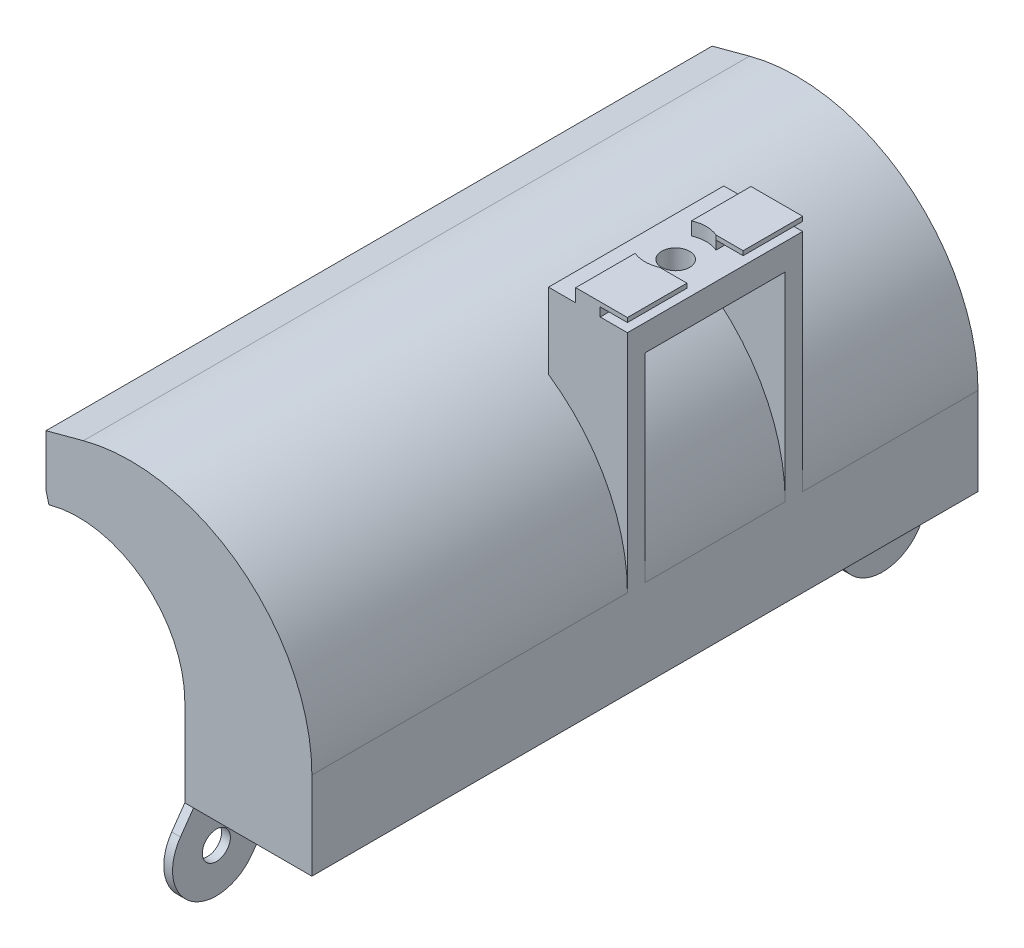
from build123d import *

# Parameters (mm, degrees)
RESSALTO_EXTRUS_O1_DEPTH          = 76
CORTE_EXTRUS_O2_DEPTH             = 91.309467661
RESSALTO_EXTRUS_O4_START          = -20
RESSALTO_EXTRUS_O4_DEPTH          = 20
CORTE_EXTRUS_O6_START             = -22
CORTE_EXTRUS_O6_DEPTH             = 16
ESBO_O12_R                        = 3.5
ESBO_O12_R_2                      = 1.6
CORTE_EXTRUS_O7_DEPTH             = 2
ESBO_O12_2_R                      = 1.6
CORTE_EXTRUS_O8_DEPTH             = 90.2814959
CORTE_EXTRUS_O8_DIRECTION_2_REACH = 91.281
RESSALTO_EXTRUS_O5_REACH          = 91.8
ESBO_O14_W                        = 6.792197014
ESBO_O14_H                        = 0.5
CASCA1_START                      = 1
CASCA1_DEPTH                      = 74
CASCA1_START_2                    = -3.278440116
CASCA1_2_OUTLINE_W                = 7
CASCA1_2_OUTLINE_H                = 18
CASCA1_2_OUTLINE_R                = 2.6
CASCA1_2_DEPTH                    = 1
CASCA1_START_3                    = -2.278440116
CASCA1_3_DEPTH                    = 1.5
RESSALTO_EXTRUS_O6_REACH          = 91.8
CORTE_EXTRUS_O9_DEPTH             = 91.309467661
CORTE_EXTRUS_O9_DEPTH_BACK        = 91.309467661
ESBO_O17_R                        = 1.6
RESSALTO_EXTRUS_O7_DEPTH          = 1


# Read off the part's stored shape, not the designer's step: Casca1
with BuildPart() as part:
    # Esboço1 → Ressalto-extrusão1 (new body)
    with BuildSketch(Plane.XY):
        with BuildLine():
            Line((-31.811733316, -8.523928252), (-26.064507457, -6.983963724))
            ThreePointArc((-26.064507457, -6.983963724), (-8.100799468, -10.557167407), (0, -26.983963724))
            Line((0, -26.983963724), (0, -36.983963724))
            Line((0, -36.983963724), (-14.5, -36.983963724))
            Line((-14.5, -36.983963724), (-14.5, -26.983963724))
            ThreePointArc((-14.5, -26.983963724), (-19.25882596, -17.334019289), (-29.811631303, -15.234935796))
            Line((-29.811631303, -15.234935796), (-30, -15.285409036))
            Line((-30, -15.285409036), (-31.811733316, -8.523928252))
        make_face()
    extrude(amount=RESSALTO_EXTRUS_O1_DEPTH)

    # Esboço3 → Corte-extrusão2 (cut, through all)
    with BuildSketch(Plane.XY.offset(76)):
        Polygon((-30.336464759, -14.029705462), (-30.336464759, -8.128631233), (-31.811733316, -8.523928252), align=None)
    extrude(amount=-CORTE_EXTRUS_O2_DEPTH, mode=Mode.SUBTRACT)

    # Esboço8 → Ressalto-extrusão4 (add)
    with BuildSketch(Plane(origin=(0, 0, 0), x_dir=(-1, 0, 0), z_dir=(0, 0, -1)).offset(RESSALTO_EXTRUS_O4_START)):
        with BuildLine():
            Line((9, -1.278440116), (5.9, -1.278440116))
            Line((5.9, -1.278440116), (5.9, 0.221559884))
            Line((5.9, 0.221559884), (3.1, 0.221559884))
            Line((3.1, 0.221559884), (3.1, -1.278440116))
            Line((3.1, -1.278440116), (0, -1.278440116))
            Line((0, -1.278440116), (0, -26.983963724))
            ThreePointArc((0, -26.983963724), (2.38766752, -17.331251347), (9, -9.90475341))
            Line((9, -9.90475341), (9, -1.278440116))
        make_face()
    extrude(amount=-RESSALTO_EXTRUS_O4_DEPTH)

    # Esboço8<3> → Corte-extrusão6 (cut)
    with BuildSketch(Plane(origin=(0, 0, 0), x_dir=(-1, 0, 0), z_dir=(0, 0, -1)).offset(CORTE_EXTRUS_O6_START)):
        with BuildLine():
            Line((9, -9.90475341), (9, -4.278440116))
            Line((9, -4.278440116), (0, -4.278440116))
            Line((0, -4.278440116), (0, -26.983963724))
            ThreePointArc((0, -26.983963724), (2.38766752, -17.331251347), (9, -9.90475341))
        make_face()
    extrude(amount=-CORTE_EXTRUS_O6_DEPTH, mode=Mode.SUBTRACT)

    # Esboço12 → Corte-extrusão7 (cut)
    with BuildSketch(Plane(origin=(0, -1.278440116, 0), x_dir=(1, 0, 0), z_dir=(0, 1, 0))):
        with Locations((-4.5, -30)):
            Circle(ESBO_O12_R)
        with Locations((-4.5, -30)):
            Circle(ESBO_O12_R_2, mode=Mode.SUBTRACT)
    extrude(amount=CORTE_EXTRUS_O7_DEPTH, mode=Mode.SUBTRACT)

    # Esboço12<2> → Corte-extrusão8 (cut)
    with BuildSketch(Plane(origin=(0, -1.278440116, 0), x_dir=(1, 0, 0), z_dir=(0, 1, 0))):
        with Locations(Location((-4.5, -30, 0), (0, 0, 180))):
            Circle(ESBO_O12_2_R)
    extrude(amount=CORTE_EXTRUS_O8_DEPTH, mode=Mode.SUBTRACT)

    # Esboço12<2> → Corte-extrusão8 direction 2 (cut, up to next)
    with BuildSketch(Plane(origin=(0, -1.278440116, 0), x_dir=(1, 0, 0), z_dir=(0, 1, 0)), mode=Mode.PRIVATE) as corte_extrus_o8_direction_2_sk1:
        with Locations(Location((-4.5, -30, 0), (0, 0, 180))):
            Circle(ESBO_O12_2_R)
    corte_extrus_o8_direction_2_tool1 = extrude(corte_extrus_o8_direction_2_sk1.sketch, amount=-CORTE_EXTRUS_O8_DIRECTION_2_REACH, mode=Mode.PRIVATE) & part.part
    add(corte_extrus_o8_direction_2_tool1.solids().sort_by_distance((-4.5, -1.27844, 30))[0], mode=Mode.SUBTRACT)

    # Esboço14 → Ressalto-extrusão5 (add, up to next)
    with BuildSketch(Plane(origin=(0, 0, 0), x_dir=(0, 0, -1), z_dir=(1, 0, 0)), mode=Mode.PRIVATE) as ressalto_extrus_o5_sk1:
        with Locations((-36.603901493, -0.028440116)):
            Rectangle(ESBO_O14_W, ESBO_O14_H)
    ressalto_extrus_o5_tool1 = extrude(ressalto_extrus_o5_sk1.sketch, amount=-RESSALTO_EXTRUS_O5_REACH, mode=Mode.PRIVATE) - part.part
    # Esboço14 → Ressalto-extrusão5 (add, up to next)
    with BuildSketch(Plane(origin=(0, 0, 0), x_dir=(0, 0, -1), z_dir=(1, 0, 0)), mode=Mode.PRIVATE) as ressalto_extrus_o5_sk2:
        with Locations((-23.396098507, -0.028440116)):
            Rectangle(ESBO_O14_W, ESBO_O14_H)
    ressalto_extrus_o5_tool2 = extrude(ressalto_extrus_o5_sk2.sketch, amount=-RESSALTO_EXTRUS_O5_REACH, mode=Mode.PRIVATE) - part.part
    add(ressalto_extrus_o5_tool1.solids().sort_by_distance((0, -0.02844, 36.603901))[0])
    add(ressalto_extrus_o5_tool2.solids().sort_by_distance((0, -0.02844, 23.396099))[0])

    # Casca1 outline → Casca1 (cut)
    with BuildSketch(Plane.XY.offset(CASCA1_START)):
        with BuildLine():
            Line((-25.805688412, -7.94988955), (-30.336464759, -9.163907414))
            Line((-30.336464759, -9.163907414), (-30.336464759, -14.029705462))
            Line((-30.336464759, -14.029705462), (-30.258819045, -14.31948321))
            Line((-30.258819045, -14.31948321), (-30.070450348, -14.269009969))
            ThreePointArc((-30.070450348, -14.269009969), (-18.650064531, -16.540665949), (-13.5, -26.983963724))
            Line((-13.5, -26.983963724), (-13.5, -36.983963724))
            Line((-13.5, -36.983963724), (-1, -36.983963724))
            Line((-1, -36.983963724), (-1, -26.983963724))
            ThreePointArc((-1, -26.983963724), (-8.709560897, -11.350520747), (-25.805688412, -7.94988955))
        make_face()
    extrude(amount=CASCA1_DEPTH, mode=Mode.SUBTRACT)

    # Casca1 2 outline → Casca1 2 (cut)
    with BuildSketch(Plane(origin=(0, 0, 0), x_dir=(1, 0, 0), z_dir=(0, 1, 0)).offset(CASCA1_START_2)):
        with Locations((-4.5, -30)):
            Rectangle(CASCA1_2_OUTLINE_W, CASCA1_2_OUTLINE_H)
        with Locations((-4.5, -30)):
            Circle(CASCA1_2_OUTLINE_R, mode=Mode.SUBTRACT)
    extrude(amount=CASCA1_2_DEPTH, mode=Mode.SUBTRACT)

    # Casca1 3 outline → Casca1 3 (cut)
    with BuildSketch(Plane(origin=(0, 0, 0), x_dir=(1, 0, 0), z_dir=(0, 1, 0)).offset(CASCA1_START_3)):
        with BuildLine():
            Line((-4.1, -25.517813034), (-4.1, -21))
            Line((-4.1, -21), (-4.9, -21))
            Line((-4.9, -21), (-4.9, -25.517813034))
            ThreePointArc((-4.9, -25.517813034), (-4.5, -25.5), (-4.1, -25.517813034))
        make_face()
        with BuildLine():
            Line((-4.9, -39), (-4.1, -39))
            Line((-4.1, -39), (-4.1, -34.482186966))
            ThreePointArc((-4.1, -34.482186966), (-4.5, -34.5), (-4.9, -34.482186966))
            Line((-4.9, -34.482186966), (-4.9, -39))
        make_face()
    extrude(amount=CASCA1_3_DEPTH, mode=Mode.SUBTRACT)

    # Esboço15 → Ressalto-extrusão6 (add, up to next)
    with BuildSketch(Plane(origin=(0, 0, 0), x_dir=(0.965925826289069, 0.2588190451025183, 0), z_dir=(-0.2588190451025183, 0.965925826289069, 0)), mode=Mode.PRIVATE) as ressalto_extrus_o6_sk1:
        Polygon((-32.933929759, -11), (-26.983963724, -15.561640627), (-26.983963724, -16.695704117), (-32.933929759, -12.13406349), align=None)
    ressalto_extrus_o6_tool1 = extrude(ressalto_extrus_o6_sk1.sketch, amount=-RESSALTO_EXTRUS_O6_REACH, mode=Mode.PRIVATE) - part.part
    # Esboço15 → Ressalto-extrusão6 (add, up to next)
    with BuildSketch(Plane(origin=(0, 0, 0), x_dir=(0.965925826289069, 0.2588190451025183, 0), z_dir=(-0.2588190451025183, 0.965925826289069, 0)), mode=Mode.PRIVATE) as ressalto_extrus_o6_sk2:
        Polygon((-32.933929759, -63.86593651), (-32.933929759, -65), (-26.983963724, -60.438359373), (-26.983963724, -59.304295883), align=None)
    ressalto_extrus_o6_tool2 = extrude(ressalto_extrus_o6_sk2.sketch, amount=-RESSALTO_EXTRUS_O6_REACH, mode=Mode.PRIVATE) - part.part
    add(ressalto_extrus_o6_tool1.solids().sort_by_distance((-28.93812, -7.753946, 13.847852))[0])
    add(ressalto_extrus_o6_tool2.solids().sort_by_distance((-28.93812, -7.753946, 62.152148))[0])

    # Esboço16 → Corte-extrusão9 (cut, two sides: drawn at the far end of the back side and taken through both)
    with BuildSketch(Plane.XY.offset(76).offset(-CORTE_EXTRUS_O9_DEPTH_BACK)):
        Polygon((-31.811733316, -8.523928252), (-30.336464759, -14.029705462), (-30.336464759, -8.128631233), align=None)
    extrude(amount=CORTE_EXTRUS_O9_DEPTH + CORTE_EXTRUS_O9_DEPTH_BACK, mode=Mode.SUBTRACT)

    # Esboço17 → Ressalto-extrusão7 (add)
    # profile 1 of 2: a face of its own
    with BuildSketch(Plane.ZY.offset(14.5)):
        with BuildLine():
            Line((0, -36.983963724), (-6.455184248, -44.800011084))
            ThreePointArc((-6.455184248, -44.800011084), (-5.78395264, -51.839147972), (1.255184248, -51.167916365))
            Line((1.255184248, -51.167916365), (12.969548739, -36.983963724))
            Line((12.969548739, -36.983963724), (0, -36.983963724))
        make_face()
        with Locations((-2.6, -47.983963724)):
            Circle(ESBO_O17_R, mode=Mode.SUBTRACT)
    # profile 2 of 2: a face of its own
    with BuildSketch(Plane.ZY.offset(14.5)):
        with BuildLine():
            Line((77.493198992, -39.1124272), (76, -36.983963724))
            Line((76, -36.983963724), (63.784615385, -36.983963724))
            Line((63.784615385, -36.983963724), (69.306801008, -44.855500248))
            ThreePointArc((69.306801008, -44.855500248), (76.271536524, -46.077162717), (77.493198992, -39.1124272))
        make_face()
        with Locations((73.4, -41.983963724)):
            Circle(ESBO_O17_R, mode=Mode.SUBTRACT)
    extrude(amount=-RESSALTO_EXTRUS_O7_DEPTH)


solid = part.part
